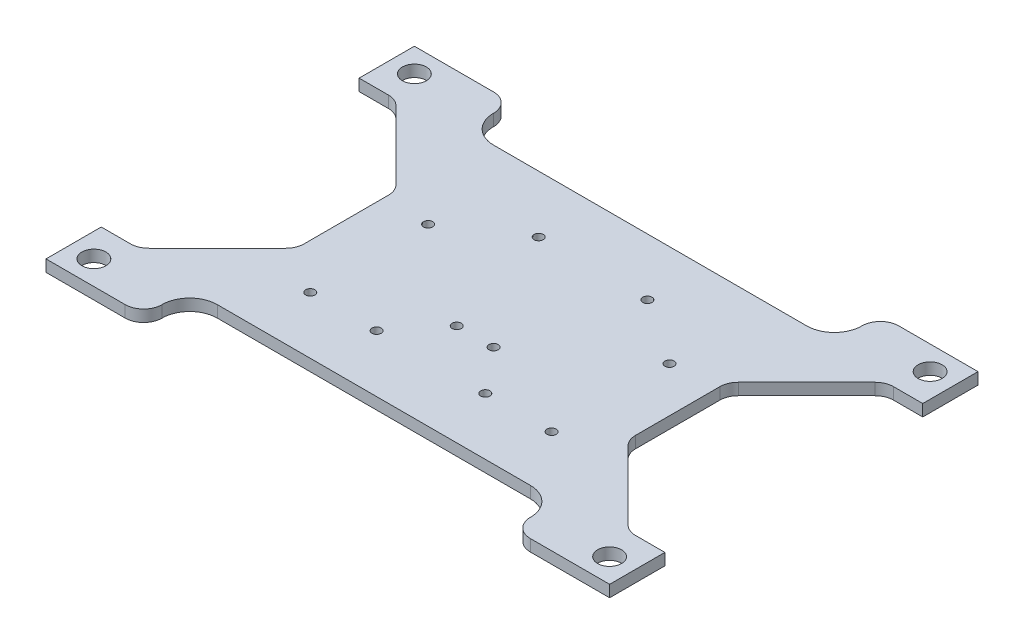
from build123d import *

# Parameters (mm, degrees)
SKETCH1_W           = 153
SKETCH1_H           = 100
SKETCH1_R           = 3.25
BOSS_EXTRUDE1_DEPTH = 3.175
CUT_EXTRUDE1_DEPTH  = 92.4457797
CUT_EXTRUDE2_DEPTH  = 92.4457797
FILLET1_R           = 5
SKETCH4_R           = 1.25
CUT_EXTRUDE3_DEPTH  = 92.4457797
SKETCH5_R           = 1.25
CUT_EXTRUDE4_DEPTH  = 92.4457797
SKETCH6_W           = 85
SKETCH6_H           = 12.5
CUT_EXTRUDE5_DEPTH  = 92.4457797


with BuildPart() as part:
    # Sketch1 → Boss-Extrude1 (new body)
    with BuildSketch(Plane(origin=(0, 0, 0), x_dir=(1, 0, 0), z_dir=(0, 1, 0))):
        Rectangle(SKETCH1_W, SKETCH1_H)
        with Locations(Location((-70, 43.5, 0), (0, 0, 270))):
            Circle(SKETCH1_R, mode=Mode.SUBTRACT)
        with Locations(Location((70, 43.5, 0), (0, 0, 270))):
            Circle(SKETCH1_R, mode=Mode.SUBTRACT)
        with Locations(Location((70, -43.5, 0), (0, 0, 270))):
            Circle(SKETCH1_R, mode=Mode.SUBTRACT)
        with Locations(Location((-70, -43.5, 0), (0, 0, 270))):
            Circle(SKETCH1_R, mode=Mode.SUBTRACT)
    extrude(amount=BOSS_EXTRUDE1_DEPTH)

    # Sketch2 → Cut-Extrude1 (cut, through all)
    with BuildSketch(Plane(origin=(0, 3.175, 0), x_dir=(1, 0, 0), z_dir=(0, 1, 0))):
        Polygon((-76.5, 35), (-66.5, 35), (-45, 13.5), (-45, -13.5), (-66.5, -35), (-76.5, -35), align=None)
        Polygon((76.5, -35), (66.5, -35), (45, -13.5), (45, 13.5), (66.5, 35), (76.5, 35), align=None)
    extrude(amount=-CUT_EXTRUDE1_DEPTH, mode=Mode.SUBTRACT)

    # Sketch3 → Cut-Extrude2 (cut, through all)
    with BuildSketch(Plane(origin=(0, 3.175, 0), x_dir=(1, 0, 0), z_dir=(0, 1, 0))):
        with BuildLine():
            Line((-50, 45), (-50, 60))
            ThreePointArc((-50, 60), (-42.5, 67.5), (-35, 60))
            Line((-35, 60), (-35, 45))
            ThreePointArc((-35, 45), (-42.5, 37.5), (-50, 45))
        make_face()
        with BuildLine():
            Line((50, 45), (50, 60))
            ThreePointArc((50, 60), (42.5, 67.5), (35, 60))
            Line((35, 60), (35, 45))
            ThreePointArc((35, 45), (42.5, 37.5), (50, 45))
        make_face()
        with BuildLine():
            Line((-50, -45), (-50, -60))
            ThreePointArc((-50, -60), (-42.5, -67.5), (-35, -60))
            Line((-35, -60), (-35, -45))
            ThreePointArc((-35, -45), (-42.5, -37.5), (-50, -45))
        make_face()
        with BuildLine():
            Line((50, -45), (50, -60))
            ThreePointArc((50, -60), (42.5, -67.5), (35, -60))
            Line((35, -60), (35, -45))
            ThreePointArc((35, -45), (42.5, -37.5), (50, -45))
        make_face()
    extrude(amount=-CUT_EXTRUDE2_DEPTH, mode=Mode.SUBTRACT)

    # Fillet1
    fillet1_edges = [part.edges().sort_by_distance(p)[0] for p in [
        (-45, 1.5875, -13.5),
        (-45, 1.5875, 13.5),
        (-66.5, 1.5875, 35),
        (-50, 1.5875, 50),
        (-35, 1.5875, 50),
        (35, 1.5875, 50),
        (50, 1.5875, 50),
        (66.5, 1.5875, 35),
        (45, 1.5875, 13.5),
        (45, 1.5875, -13.5),
        (66.5, 1.5875, -35),
        (50, 1.5875, -50),
        (35, 1.5875, -50),
        (-35, 1.5875, -50),
        (-50, 1.5875, -50),
        (-66.5, 1.5875, -35),
    ]]
    fillet(fillet1_edges, radius=FILLET1_R - 0.0001)  # a hair under: the kernel refuses the full size

    # Sketch4 → Cut-Extrude3 (cut, through all)
    with BuildSketch(Plane(origin=(0, 3.175, 0), x_dir=(1, 0, 0), z_dir=(0, 1, 0))):
        with Locations(Location((-32.76, 10, 0), (0, 0, 270))):
            Circle(SKETCH4_R)
        with Locations(Location((-14.76, 22, 0), (0, 0, 270))):
            Circle(SKETCH4_R)
        with Locations(Location((-14.76, -22, 0), (0, 0, 270))):
            Circle(SKETCH4_R)
        with Locations(Location((-32.76, -22, 0), (0, 0, 270))):
            Circle(SKETCH4_R)
        with Locations(Location((32.76, -22, 0), (0, 0, 90))):
            Circle(SKETCH4_R)
        with Locations(Location((14.76, -22, 0), (0, 0, 90))):
            Circle(SKETCH4_R)
        with Locations(Location((14.76, 22, 0), (0, 0, 90))):
            Circle(SKETCH4_R)
        with Locations(Location((32.76, 10, 0), (0, 0, 90))):
            Circle(SKETCH4_R)
    extrude(amount=-CUT_EXTRUDE3_DEPTH, mode=Mode.SUBTRACT)

    # Sketch5 → Cut-Extrude4 (cut, through all)
    with BuildSketch(Plane(origin=(0, 3.175, 0), x_dir=(1, 0, 0), z_dir=(0, 1, 0))):
        with Locations(Location((-5, -10, 0), (0, 0, 270))):
            Circle(SKETCH5_R)
        with Locations(Location((5, -10, 0), (0, 0, 270))):
            Circle(SKETCH5_R)
    extrude(amount=-CUT_EXTRUDE4_DEPTH, mode=Mode.SUBTRACT)

    # Sketch6 → Cut-Extrude5 (cut, through all)
    with BuildSketch(Plane(origin=(0, 3.175, 0), x_dir=(1, 0, 0), z_dir=(0, 1, 0))):
        with Locations((0, 43.75)):
            Rectangle(SKETCH6_W, SKETCH6_H)
        with Locations((0, -43.75)):
            Rectangle(SKETCH6_W, SKETCH6_H)
    extrude(amount=-CUT_EXTRUDE5_DEPTH, mode=Mode.SUBTRACT)


solid = part.part
